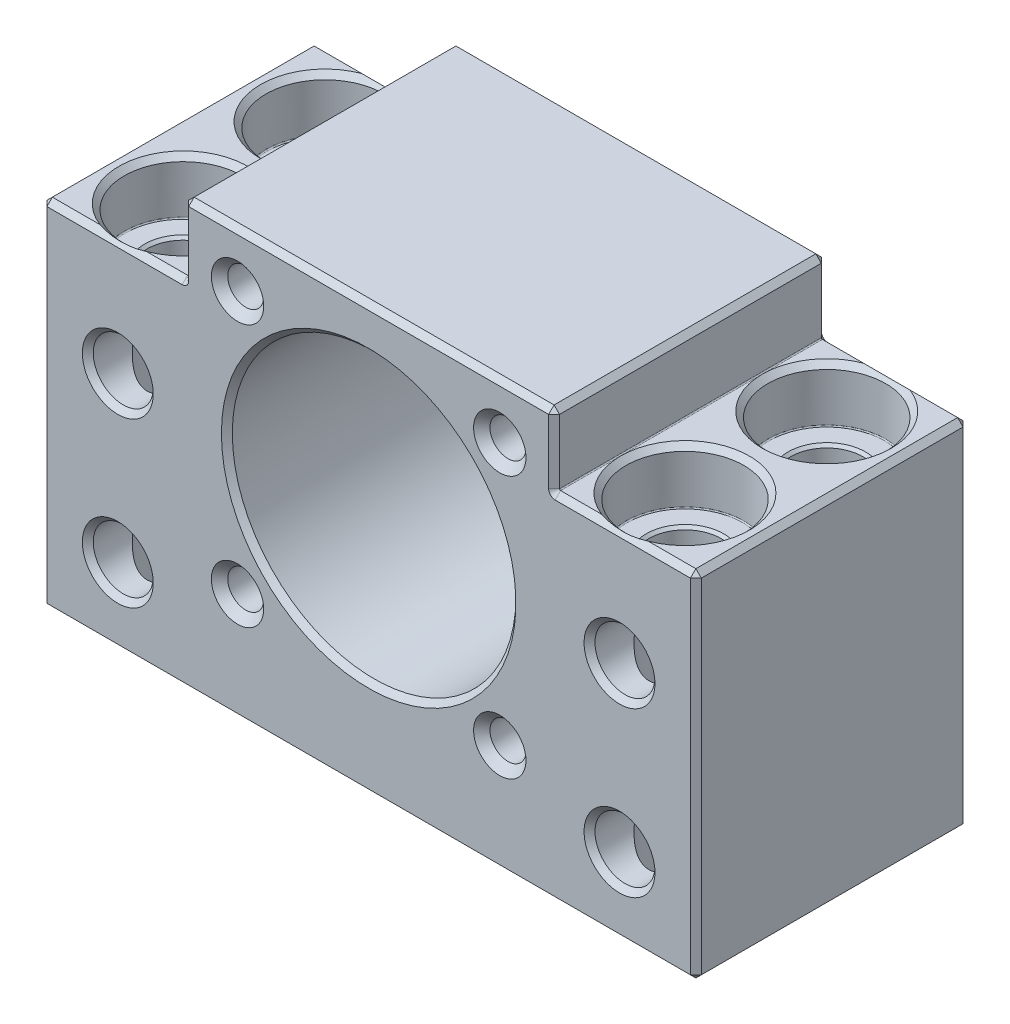
from build123d import *

# Parameters (mm, degrees)
BK_BODY_DEPTH               = 12.5
BK_FLANGE_DEPTH             = 40.246018906
BK_FLANGE_DEPTH_BACK        = 40.246018906
BK_B_FLANGE_R               = 11
BK_B_HOLE_R                 = 13
BK_B_HOLE_R_2               = 11
BK_BEARING_DEPTH            = 20
VERTICAL_HOLES_AT_2_COUNT   = 2
VERTICAL_HOLES_AT_2_PITCH   = 13
VERTICAL_HOLES_AT_3_COUNT   = 2
VERTICAL_HOLES_AT_3_PITCH   = 46
VERTICAL_HOLES_AT_4_COUNT   = 2
VERTICAL_HOLES_AT_4_PITCH   = 47.801673611
HORIZONTAL_HOLES_AT_2_COUNT = 2
HORIZONTAL_HOLES_AT_2_PITCH = 15
HORIZONTAL_HOLES_AT_3_COUNT = 2
HORIZONTAL_HOLES_AT_3_PITCH = 46
HORIZONTAL_HOLES_AT_4_COUNT = 2
HORIZONTAL_HOLES_AT_4_PITCH = 48.383881614
FLANGE_HOLES_D              = 3.3
FLANGE_HOLES_DEPTH          = 11.5
FLANGE_HOLES_CSINK_D        = 4.8
FLANGE_HOLES_CSINK_ANGLE    = 90
FLANGE_HOLES_TIP            = 0.991420021
BEARING_FILLET_R            = 0.15
PRODUCTION_FILLET_R         = 0.1


# Some blends are built 0.0001 mm under size
with BuildPart() as part:
    # BK Body Sketch → BK Body (new, symmetric)
    with BuildSketch(Plane.XY):
        Polygon((30, -22), (-30, -22), (-30, 10.5), (-17, 10.5), (-17, 17), (17, 17), (17, 10.5), (30, 10.5), align=None)
    extrude(amount=BK_BODY_DEPTH, both=True)

    # BK B-Flange → BK Flange (cut, two sides: drawn at the far end of the back side and taken through both)
    with BuildSketch(Plane.XY.offset(-BK_FLANGE_DEPTH_BACK)):
        Circle(BK_B_FLANGE_R)
    extrude(amount=BK_FLANGE_DEPTH + BK_FLANGE_DEPTH_BACK, mode=Mode.SUBTRACT)

    # BK B-Hole → BK Bearing (cut)
    with BuildSketch(Plane.XY.offset(12.5)):
        Circle(BK_B_HOLE_R)
        Circle(BK_B_HOLE_R_2, mode=Mode.SUBTRACT)
    extrude(amount=-BK_BEARING_DEPTH, mode=Mode.SUBTRACT)

    # Sketch2 → Vertical Holes (revolve, cut)
    with BuildSketch(Plane(origin=(-23, 10.5, -6.5), x_dir=(0, 0, 1), z_dir=(1, 0, 0))):
        Polygon((0, 0), (0, 32.5), (3.8, 32.5), (3.3, 32), (3.3, 5.25), (3.55, 5), (5.4, 5), (5.4, 0.5), (5.9, 0), align=None)
    vertical_holes = revolve(axis=Axis((-23, 16.85, -6.5), (0, -1, 0)), mode=Mode.SUBTRACT)

    # Vertical Holes at 2: Vertical Holes ×2
    with Locations(*[(0, 0, i * VERTICAL_HOLES_AT_2_PITCH) for i in range(1, VERTICAL_HOLES_AT_2_COUNT)]):
        add(vertical_holes, mode=Mode.SUBTRACT)

    # Vertical Holes at 3: Vertical Holes ×2
    with Locations(*[(i * VERTICAL_HOLES_AT_3_PITCH, 0, 0) for i in range(1, VERTICAL_HOLES_AT_3_COUNT)]):
        add(vertical_holes, mode=Mode.SUBTRACT)

    # Vertical Holes at 4: Vertical Holes ×2
    with Locations(*[Vector(0.9623094031071993, 0, 0.2719570052259475) * (i * VERTICAL_HOLES_AT_4_PITCH) for i in range(1, VERTICAL_HOLES_AT_4_COUNT)]):
        add(vertical_holes, mode=Mode.SUBTRACT)

    # Sketch4 → Horizontal Holes (revolve, cut)
    with BuildSketch(Plane(origin=(-23, 0, 12.5), x_dir=(0, -1, 0), z_dir=(1, 0, 0))):
        Polygon((0, 0), (0, 25), (3.25, 25), (2.75, 24.5), (2.75, 0.5), (3.25, 0), align=None)
    horizontal_holes = revolve(axis=Axis((-23, 0, 18.85), (0, 0, -1)), mode=Mode.SUBTRACT)

    # Horizontal Holes at 2: Horizontal Holes ×2
    with Locations(*[(0, -i * HORIZONTAL_HOLES_AT_2_PITCH, 0) for i in range(1, HORIZONTAL_HOLES_AT_2_COUNT)]):
        add(horizontal_holes, mode=Mode.SUBTRACT)

    # Horizontal Holes at 3: Horizontal Holes ×2
    with Locations(*[(i * HORIZONTAL_HOLES_AT_3_PITCH, 0, 0) for i in range(1, HORIZONTAL_HOLES_AT_3_COUNT)]):
        add(horizontal_holes, mode=Mode.SUBTRACT)

    # Horizontal Holes at 4: Horizontal Holes ×2
    with Locations(*[Vector(0.9507298394814789, -0.31002059983091673, 0) * (i * HORIZONTAL_HOLES_AT_4_PITCH) for i in range(1, HORIZONTAL_HOLES_AT_4_COUNT)]):
        add(horizontal_holes, mode=Mode.SUBTRACT)

    # Flange Holes
    with Locations(Plane.XY.offset(12.5)):
        with Locations((-12.02081528, 12.02081528), (12.02081528, 12.02081528), (12.02081528, -12.02081528), (-12.02081528, -12.02081528)):
            CounterSinkHole(FLANGE_HOLES_D / 2, FLANGE_HOLES_CSINK_D / 2, depth=FLANGE_HOLES_DEPTH, counter_sink_angle=FLANGE_HOLES_CSINK_ANGLE)
            with Locations((0, 0, -(FLANGE_HOLES_DEPTH + FLANGE_HOLES_TIP / 2))):  # 118° drill point
                Cone(0, FLANGE_HOLES_D / 2, FLANGE_HOLES_TIP, mode=Mode.SUBTRACT)

    # Bearing Fillet
    bearing_fillet_edges = [part.edges().sort_by_distance(p)[0] for p in [
        (-13, 0, -7.5),
    ]]
    fillet(bearing_fillet_edges, radius=BEARING_FILLET_R)

    # Production Fillet
    production_fillet_edges = [part.edges().sort_by_distance(p)[0] for p in [
        (-17, 10.5, 0),
        (17, 10.5, 0),
        (23, 5.5, 1.1),
        (23, 5.5, -11.9),
        (-23, 5.5, 1.1),
        (-23, 5.5, -11.9),
    ]]
    fillet(production_fillet_edges, radius=PRODUCTION_FILLET_R - 0.0001)  # a hair under: the kernel refuses the full size

    # Aesthetic Chamfer
    # the kernel refuses this chamfer: 0.5 mm, written as the material it takes off along each edge
    with BuildSketch(Plane(origin=(29.666666667, 10.166666667, -12.166666667), x_dir=(0, -0.7071067811865475, -0.7071067811865475), z_dir=(0.5773502691896258, 0.5773502691896258, -0.5773502691896258)), Plane(origin=(29.666666667, -21.666666667, -12.166666667), x_dir=(0, -0.7071067811865475, 0.7071067811865475), z_dir=(0.5773502691896258, -0.5773502691896258, -0.5773502691896258)), Plane(origin=(-16.666666667, 16.666666667, 12.166666667), x_dir=(-0.7071067811865475, 0, -0.7071067811865475), z_dir=(-0.5773502691896258, 0.5773502691896258, 0.5773502691896258)), Plane(origin=(-29.666666667, 10.166666667, -12.166666667), x_dir=(-0.7071067811865475, -0.7071067811865475, 0), z_dir=(-0.5773502691896258, 0.5773502691896258, -0.5773502691896258)), Plane(origin=(-16.666666667, 16.666666667, -12.166666667), x_dir=(0.7071067811865475, 0, -0.7071067811865475), z_dir=(-0.5773502691896258, 0.5773502691896258, -0.5773502691896258)), Plane(origin=(29.666666667, 10.166666667, 12.166666667), x_dir=(0, 0.7071067811865475, -0.7071067811865475), z_dir=(0.5773502691896258, 0.5773502691896258, 0.5773502691896258))) as aesthetic_chamfer_piece_1:
        Polygon((-0.353553391, 0.204124145), (0.353553391, 0.204124145), (0, -0.40824829), align=None)
    extrude(amount=0.635085296, mode=Mode.SUBTRACT)
    with BuildSketch(Plane(origin=(16.666666667, 16.666666667, 12.166666667), x_dir=(0.7071067811865475, 0, -0.7071067811865475), z_dir=(0.5773502691896258, 0.5773502691896258, 0.5773502691896258)), Plane(origin=(29.666666667, -21.666666667, 12.166666667), x_dir=(0, -0.7071067811865475, -0.7071067811865475), z_dir=(0.5773502691896258, -0.5773502691896258, 0.5773502691896258)), Plane(origin=(-29.666666667, -21.666666667, 12.166666667), x_dir=(-0.7071067811865475, 0, -0.7071067811865475), z_dir=(-0.5773502691896258, -0.5773502691896258, 0.5773502691896258)), Plane(origin=(-29.666666667, -21.666666667, -12.166666667), x_dir=(0.7071067811865475, 0, -0.7071067811865475), z_dir=(-0.5773502691896258, -0.5773502691896258, -0.5773502691896258)), Plane(origin=(-29.666666667, 10.166666667, 12.166666667), x_dir=(0, 0.7071067811865475, -0.7071067811865475), z_dir=(-0.5773502691896258, 0.5773502691896258, 0.5773502691896258)), Plane(origin=(16.666666667, 16.666666667, -12.166666667), x_dir=(-0.7071067811865475, 0, -0.7071067811865475), z_dir=(0.5773502691896258, 0.5773502691896258, -0.5773502691896258))) as aesthetic_chamfer_piece_2:
        Polygon((-0.353553391, -0.204124145), (0.353553391, -0.204124145), (0, 0.40824829), align=None)
    extrude(amount=0.635085296, mode=Mode.SUBTRACT)
    with BuildSketch(Plane(origin=(17.0999, 10.5, -12.5), x_dir=(0, 0.027495876610585647, 0.9996219169112968), z_dir=(1, 0, 0)), Plane(origin=(-31.285841494, 10.5, -12.5), x_dir=(0, 0.027495876610585647, 0.9996219169112968), z_dir=(1, 0, 0)), Plane(origin=(-31.285841494, 10.5, 12.5), x_dir=(0, -0.9996219169112968, 0.027495876610585647), z_dir=(1, 0, 0)), Plane(origin=(17.0999, 10.5, 12.5), x_dir=(0, -0.9996219169112968, 0.027495876610585647), z_dir=(1, 0, 0))) as aesthetic_chamfer_piece_3:
        with BuildLine():
            Line((0.514336598, 0), (-0.028273577, 0.513558897))
            Line((-0.028273577, 0.513558897), (-0.038269797, 0.513283938))
            ThreePointArc((-0.038269797, 0.513283938), (-0.017064614, 0.256698915), (-0.009996219, -0.000274959))
            Line((-0.009996219, -0.000274959), (0.000274959, -0.009996219))
            ThreePointArc((0.000274959, -0.009996219), (0.257248832, -0.002927825), (0.514611556, -0.009996219))
            Line((0.514611556, -0.009996219), (0.514336598, 0))
        make_face()
    extrude(amount=14.185941494, mode=Mode.SUBTRACT)
    with BuildSketch(Plane(origin=(30, 11.785841494, -12.5), x_dir=(0.0274958766105891, 0, 0.9996219169112968), z_dir=(0, -1, 0)), Plane(origin=(-30, -23.285841494, 12.5), x_dir=(0.9996219169112968, 0, 0.02749587661058555), z_dir=(0, 1, 0)), Plane(origin=(30, 11.785841494, 12.5), x_dir=(-0.9996219169112968, 0, 0.02749587661058555), z_dir=(0, -1, 0)), Plane(origin=(-30, -23.285841494, -12.5), x_dir=(-0.0274958766105891, 0, 0.9996219169112968), z_dir=(0, 1, 0))) as aesthetic_chamfer_piece_4:
        with BuildLine():
            Line((0.514336598, 0), (-0.028273577, 0.513558897))
            Line((-0.028273577, 0.513558897), (-0.038269797, 0.513283938))
            ThreePointArc((-0.038269797, 0.513283938), (-0.017064614, 0.256698915), (-0.009996219, -0.000274959))
            Line((-0.009996219, -0.000274959), (0.000274959, -0.009996219))
            ThreePointArc((0.000274959, -0.009996219), (0.257248832, -0.002927825), (0.514611556, -0.009996219))
            Line((0.514611556, -0.009996219), (0.514336598, 0))
        make_face()
    extrude(amount=35.071682988, mode=Mode.SUBTRACT)
    with BuildSketch(Plane(origin=(-18.285841494, 17, 12.5), x_dir=(0, -0.9996219169112968, 0.02749587661058555), z_dir=(1, 0, 0)), Plane(origin=(-18.285841494, 17, -12.5), x_dir=(0, 0.0274958766105891, 0.9996219169112968), z_dir=(1, 0, 0))) as aesthetic_chamfer_piece_5:
        with BuildLine():
            Line((0.514336598, 0), (-0.028273577, 0.513558897))
            Line((-0.028273577, 0.513558897), (-0.038269797, 0.513283938))
            ThreePointArc((-0.038269797, 0.513283938), (-0.017064614, 0.256698915), (-0.009996219, -0.000274959))
            Line((-0.009996219, -0.000274959), (0.000274959, -0.009996219))
            ThreePointArc((0.000274959, -0.009996219), (0.257248832, -0.002927825), (0.514611556, -0.009996219))
            Line((0.514611556, -0.009996219), (0.514336598, 0))
        make_face()
    extrude(amount=36.571682988, mode=Mode.SUBTRACT)
    with BuildSketch(Plane(origin=(30, -22, -13.785841494), x_dir=(-0.9996219169112968, -0.027495876610589005, 0), z_dir=(0, 0, 1)), Plane(origin=(-17, 17, 13.785841494), x_dir=(-0.027495876610589005, -0.9996219169112968, 0), z_dir=(0, 0, -1)), Plane(origin=(17, 17, 13.785841494), x_dir=(-0.9996219169112968, 0.027495876610589005, 0), z_dir=(0, 0, -1)), Plane(origin=(30, 10.5, -13.785841494), x_dir=(0.0274958766105891, -0.9996219169112968, 0), z_dir=(0, 0, 1))) as aesthetic_chamfer_piece_6:
        with BuildLine():
            Line((0.514336598, 0), (-0.028273577, -0.513558897))
            Line((-0.028273577, -0.513558897), (-0.038269797, -0.513283938))
            ThreePointArc((-0.038269797, -0.513283938), (-0.017064614, -0.256698915), (-0.009996219, 0.000274959))
            Line((-0.009996219, 0.000274959), (0.000274959, 0.009996219))
            ThreePointArc((0.000274959, 0.009996219), (0.257248832, 0.002927825), (0.514611556, 0.009996219))
            Line((0.514611556, 0.009996219), (0.514336598, 0))
        make_face()
    extrude(amount=27.571682988, mode=Mode.SUBTRACT)
    with BuildSketch(Plane(origin=(-30, -22, 13.785841494), x_dir=(-0.027495876610589005, 0.9996219169112968, 0), z_dir=(0, 0, -1)), Plane(origin=(-30, 10.5, 13.785841494), x_dir=(0.9996219169112968, 0.02749587661058555, 0), z_dir=(0, 0, -1))) as aesthetic_chamfer_piece_7:
        with BuildLine():
            Line((0.514336598, 0), (-0.028273577, 0.513558897))
            Line((-0.028273577, 0.513558897), (-0.038269797, 0.513283938))
            ThreePointArc((-0.038269797, 0.513283938), (-0.017064614, 0.256698915), (-0.009996219, -0.000274959))
            Line((-0.009996219, -0.000274959), (0.000274959, -0.009996219))
            ThreePointArc((0.000274959, -0.009996219), (0.257248832, -0.002927825), (0.514611556, -0.009996219))
            Line((0.514611556, -0.009996219), (0.514336598, 0))
        make_face()
    extrude(amount=27.571682988, mode=Mode.SUBTRACT)
    with BuildSketch(Plane(origin=(-17, 10.5999, 12.5), x_dir=(0.9996219169112968, 0, 0.02749587661058555), z_dir=(0, 1, 0)), Plane(origin=(17, 18.285841494, -12.5), x_dir=(0.0274958766105891, 0, 0.9996219169112968), z_dir=(0, -1, 0)), Plane(origin=(17, 18.285841494, 12.5), x_dir=(-0.9996219169112968, 0, 0.02749587661058555), z_dir=(0, -1, 0)), Plane(origin=(-17, 10.5999, -12.5), x_dir=(-0.0274958766105891, 0, 0.9996219169112968), z_dir=(0, 1, 0))) as aesthetic_chamfer_piece_8:
        with BuildLine():
            Line((0.514336598, 0), (-0.028273577, 0.513558897))
            Line((-0.028273577, 0.513558897), (-0.038269797, 0.513283938))
            ThreePointArc((-0.038269797, 0.513283938), (-0.017064614, 0.256698915), (-0.009996219, -0.000274959))
            Line((-0.009996219, -0.000274959), (0.000274959, -0.009996219))
            ThreePointArc((0.000274959, -0.009996219), (0.257248832, -0.002927825), (0.514611556, -0.009996219))
            Line((0.514611556, -0.009996219), (0.514336598, 0))
        make_face()
    extrude(amount=7.685941494, mode=Mode.SUBTRACT)
    with BuildSketch(Plane(origin=(-17.0999, 10.5999, -12.5), x_dir=(0, -1, 0), z_dir=(-1, 0, 0))) as aesthetic_chamfer_piece_9:
        with BuildLine():
            Line((0.085757864, 0.514142136), (0.614042136, -0.014142136))
            Line((0.614042136, -0.014142136), (0.614042136, -0.024142136))
            ThreePointArc((0.614042136, -0.024142136), (0.356971068, -0.01), (0.0999, -0.01))
            Line((0.0999, -0.01), (0.0899, 0))
            ThreePointArc((0.0899, 0), (0.0899, 0.257071068), (0.075757864, 0.514142136))
            Line((0.075757864, 0.514142136), (0.085757864, 0.514142136))
        make_face()
    revolve(axis=Axis((-17.0999, 10.5999, -12.5), (0, 0, 1)), revolution_arc=90, mode=Mode.SUBTRACT)
    with BuildSketch(Plane(origin=(-17.0999, 10.5999, 12.5), x_dir=(0, -1, 0), z_dir=(-1, 0, 0))) as aesthetic_chamfer_piece_10:
        with BuildLine():
            Line((0.614042136, 0.014142136), (0.085757864, -0.514142136))
            Line((0.085757864, -0.514142136), (0.075757864, -0.514142136))
            ThreePointArc((0.075757864, -0.514142136), (0.0899, -0.257071068), (0.0899, 0))
            Line((0.0899, 0), (0.0999, 0.01))
            ThreePointArc((0.0999, 0.01), (0.356971068, 0.01), (0.614042136, 0.024142136))
            Line((0.614042136, 0.024142136), (0.614042136, 0.014142136))
        make_face()
    revolve(axis=Axis((-17.0999, 10.5999, 12.5), (0, 0, 1)), revolution_arc=90, mode=Mode.SUBTRACT)
    with BuildSketch(Plane(origin=(17.0999, 10.5999, -12.5), x_dir=(-1, 0, 0), z_dir=(0, 1, 0))) as aesthetic_chamfer_piece_11:
        with BuildLine():
            Line((0.085757864, 0.514142136), (0.614042136, -0.014142136))
            Line((0.614042136, -0.014142136), (0.614042136, -0.024142136))
            ThreePointArc((0.614042136, -0.024142136), (0.356971068, -0.01), (0.0999, -0.01))
            Line((0.0999, -0.01), (0.0899, 0))
            ThreePointArc((0.0899, 0), (0.0899, 0.257071068), (0.075757864, 0.514142136))
            Line((0.075757864, 0.514142136), (0.085757864, 0.514142136))
        make_face()
    revolve(axis=Axis((17.0999, 10.5999, -12.5), (0, 0, 1)), revolution_arc=90, mode=Mode.SUBTRACT)
    with BuildSketch(Plane(origin=(17.0999, 10.5999, 12.5), x_dir=(-1, 0, 0), z_dir=(0, 1, 0))) as aesthetic_chamfer_piece_12:
        with BuildLine():
            Line((0.614042136, 0.014142136), (0.085757864, -0.514142136))
            Line((0.085757864, -0.514142136), (0.075757864, -0.514142136))
            ThreePointArc((0.075757864, -0.514142136), (0.0899, -0.257071068), (0.0899, 0))
            Line((0.0899, 0), (0.0999, 0.01))
            ThreePointArc((0.0999, 0.01), (0.356971068, 0.01), (0.614042136, 0.024142136))
            Line((0.614042136, 0.024142136), (0.614042136, 0.014142136))
        make_face()
    revolve(axis=Axis((17.0999, 10.5999, 12.5), (0, 0, 1)), revolution_arc=90, mode=Mode.SUBTRACT)
    with BuildSketch(Plane(origin=(0, 0, -12.5), x_dir=(1, 0, 0), z_dir=(0, -1, 0))) as aesthetic_chamfer_piece_13:
        with BuildLine():
            Line((11.514142136, -0.014142136), (10.985857864, 0.514142136))
            Line((10.985857864, 0.514142136), (10.975857864, 0.514142136))
            ThreePointArc((10.975857864, 0.514142136), (10.99, 0.257071068), (10.99, 0))
            Line((10.99, 0), (11, -0.01))
            ThreePointArc((11, -0.01), (11.257071068, -0.01), (11.514142136, -0.024142136))
            Line((11.514142136, -0.024142136), (11.514142136, -0.014142136))
        make_face()
    revolve(axis=Axis((0, 0, -12.5), (0, 0, 1)), mode=Mode.SUBTRACT)
    with BuildSketch(Plane(origin=(31.285841494, -22, 12.5), x_dir=(0, 0.9996219169112968, 0.02749587661058555), z_dir=(-1, 0, 0)), Plane(origin=(31.285841494, -22, -12.5), x_dir=(0, -0.0274958766105891, 0.9996219169112968), z_dir=(-1, 0, 0))) as aesthetic_chamfer_piece_14:
        with BuildLine():
            Line((0.514336598, 0), (-0.028273577, 0.513558897))
            Line((-0.028273577, 0.513558897), (-0.038269797, 0.513283938))
            ThreePointArc((-0.038269797, 0.513283938), (-0.017064614, 0.256698915), (-0.009996219, -0.000274959))
            Line((-0.009996219, -0.000274959), (0.000274959, -0.009996219))
            ThreePointArc((0.000274959, -0.009996219), (0.257248832, -0.002927825), (0.514611556, -0.009996219))
            Line((0.514611556, -0.009996219), (0.514336598, 0))
        make_face()
    extrude(amount=62.571682988, mode=Mode.SUBTRACT)
    with BuildSketch(Plane(origin=(0, 0, 12.5), x_dir=(1, 0, 0), z_dir=(0, -1, 0))) as aesthetic_chamfer_piece_15:
        with BuildLine():
            Line((13.514142136, 0.014142136), (12.985857864, -0.514142136))
            Line((12.985857864, -0.514142136), (12.975857864, -0.514142136))
            ThreePointArc((12.975857864, -0.514142136), (12.99, -0.257071068), (12.99, 0))
            Line((12.99, 0), (13, 0.01))
            ThreePointArc((13, 0.01), (13.257071068, 0.01), (13.514142136, 0.024142136))
            Line((13.514142136, 0.024142136), (13.514142136, 0.014142136))
        make_face()
    revolve(axis=Axis((0, 0, 12.5), (0, 0, 1)), mode=Mode.SUBTRACT)
    with BuildSketch(Plane(origin=(0, 0, -7.5), x_dir=(1, 0, 0), z_dir=(0, -1, 0))) as aesthetic_chamfer_piece_16:
        with BuildLine():
            Line((10.985857864, -0.514142136), (11.514142136, 0.014142136))
            Line((11.514142136, 0.014142136), (11.514142136, 0.024142136))
            ThreePointArc((11.514142136, 0.024142136), (11.257071068, 0.01), (11, 0.01))
            Line((11, 0.01), (10.99, 0))
            ThreePointArc((10.99, 0), (10.99, -0.257071068), (10.975857864, -0.514142136))
            Line((10.975857864, -0.514142136), (10.985857864, -0.514142136))
        make_face()
    revolve(axis=Axis((0, 0, -7.5), (0, 0, 1)), mode=Mode.SUBTRACT)


solid = part.part
